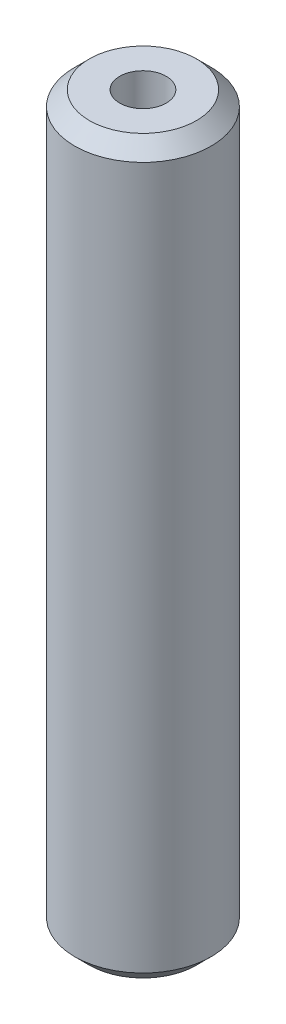
from build123d import *

# Parameters (mm, degrees)
SKETCH1_R           = 10
BOSS_EXTRUDE1_DEPTH = 107.185138911
SKETCH2_R           = 3.40942067
CUT_EXTRUDE1_DEPTH  = 109.114078655
CHAMFER1_SIZE       = 2.157369745


with BuildPart() as part:
    # Sketch1 → Boss-Extrude1 (new body)
    with BuildSketch(Plane(origin=(0, 0, 0), x_dir=(1, 0, 0), z_dir=(0, 1, 0))):
        Circle(SKETCH1_R)
    extrude(amount=BOSS_EXTRUDE1_DEPTH)

    # Sketch2 → Cut-Extrude1 (cut, through all)
    with BuildSketch(Plane(origin=(0, 0, 0), x_dir=(1, 0, 0), z_dir=(0, 1, 0))):
        Circle(SKETCH2_R)
    extrude(amount=CUT_EXTRUDE1_DEPTH, mode=Mode.SUBTRACT)

    # Chamfer1
    chamfer1_edges = [part.edges().sort_by_distance(p)[0] for p in [
        (-10, 107.185138911, 0),
        (-10, 0, 0),
    ]]
    chamfer(chamfer1_edges, length=CHAMFER1_SIZE)


solid = part.part
